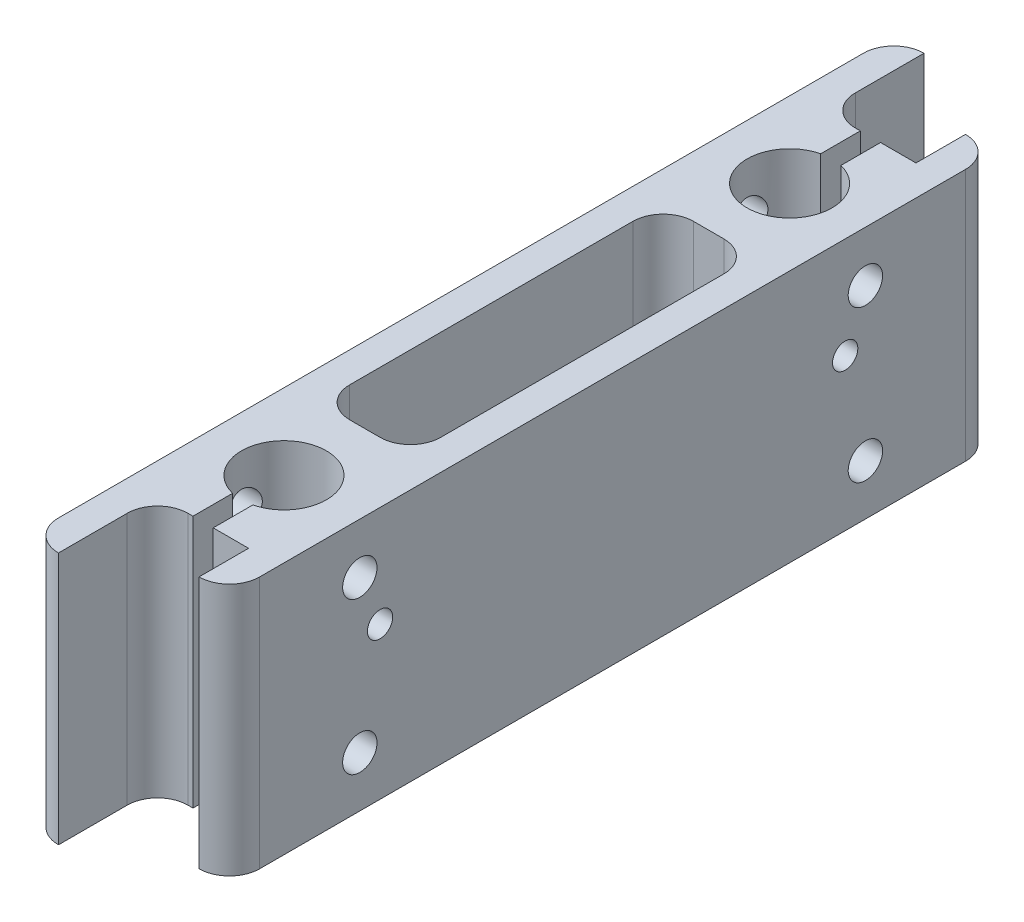
from build123d import *

# Parameters (mm, degrees)
SKETCH_2_R          = 4.2
EXTRUDE_1_DEPTH     = 25
FILLET_1_R          = 3
CUT_EXTRUDE_1_DEPTH = 25
SKETCH_4_W          = 2
SKETCH_4_H          = 9.772408651
SKETCH_4_H_2        = 10.02993421
CUT_EXTRUDE_2_DEPTH = 25
SKETCH_5_R          = 1.25
CUT_EXTRUDE_3_DEPTH = 35
SKETCH_6_R          = 1.7
CUT_EXTRUDE_4_DEPTH = 32


with BuildPart() as part:
    # 草图2 → 凸台-拉伸1 (new body)
    with BuildSketch(Plane(origin=(0, 0, 0), x_dir=(1, 0, 0), z_dir=(0, 1, 0))):
        Polygon((-10.5, 44.6), (-10.5, 34.8), (-1.5, 34.8), (-1.5, 39.7), (1.5, 39.7), (1.5, -36.1), (-1.5, -36.1), (-1.5, -31.2), (-10.5, -31.2), (-10.5, -41), (-13.5, -41), (-13.5, 44.6), align=None)
        with Locations(Location((-6, -23.2, 0), (0, 0, 270))):
            Circle(SKETCH_2_R, mode=Mode.SUBTRACT)
        with Locations(Location((-6, 26.8, 0), (0, 0, 270))):
            Circle(SKETCH_2_R, mode=Mode.SUBTRACT)
    extrude(amount=EXTRUDE_1_DEPTH)

    # 圆角1
    fillet_1_edges = [part.edges().sort_by_distance(p)[0] for p in [
        (1.5, 12.5, 36.1),
        (1.5, 12.5, -39.7),
        (-10.5, 12.5, -34.8),
        (-10.5, 12.5, 31.2),
        (-13.5, 12.5, -44.6),
        (-13.5, 12.5, 41),
    ]]
    fillet(fillet_1_edges, radius=FILLET_1_R - 0.0001)  # a hair under: the kernel refuses the full size

    # 草图3 → 切除-拉伸1 (cut)
    with BuildSketch(Plane(origin=(0, 25, 0), x_dir=(1, 0, 0), z_dir=(0, 1, 0))):
        with BuildLine():
            Line((-7.5, 18.8), (-4.5, 18.8))
            ThreePointArc((-4.5, 18.8), (-2.378679656, 17.921320344), (-1.5, 15.8))
            Line((-1.5, 15.8), (-1.5, -12.2))
            ThreePointArc((-1.5, -12.2), (-2.378679656, -14.321320344), (-4.5, -15.2))
            Line((-4.5, -15.2), (-7.5, -15.2))
            ThreePointArc((-7.5, -15.2), (-9.621320344, -14.321320344), (-10.5, -12.2))
            Line((-10.5, -12.2), (-10.5, 15.8))
            ThreePointArc((-10.5, 15.8), (-9.621320344, 17.921320344), (-7.5, 18.8))
        make_face()
    extrude(amount=-CUT_EXTRUDE_1_DEPTH, mode=Mode.SUBTRACT)

    # 草图4 → 切除-拉伸2 (cut)
    with BuildSketch(Plane(origin=(0, 25, 0), x_dir=(1, 0, 0), z_dir=(0, 1, 0))):
        with Locations((-6, -31.836216801)):
            Rectangle(SKETCH_4_W, SKETCH_4_H)
        with Locations((-6, 32.148208176)):
            Rectangle(SKETCH_4_W, SKETCH_4_H_2)
    extrude(amount=-CUT_EXTRUDE_2_DEPTH, mode=Mode.SUBTRACT)

    # 草图5 → 切除-拉伸3 (cut)
    with BuildSketch(Plane(origin=(1.5, 0, 0), x_dir=(0, 0, -1), z_dir=(1, 0, 0))):
        with Locations((-21.2, 15)):
            Circle(SKETCH_5_R)
        with Locations((24.8, 15)):
            Circle(SKETCH_5_R)
    extrude(amount=-CUT_EXTRUDE_3_DEPTH, mode=Mode.SUBTRACT)

    # 草图6 → 切除-拉伸4 (cut)
    with BuildSketch(Plane(origin=(1.5, 0, 0), x_dir=(0, 0, -1), z_dir=(1, 0, 0))):
        with Locations((26.8, 5)):
            Circle(SKETCH_6_R)
        with Locations((26.8, 20)):
            Circle(SKETCH_6_R)
        with Locations((-23.2, 5)):
            Circle(SKETCH_6_R)
        with Locations((-23.2, 20)):
            Circle(SKETCH_6_R)
    extrude(amount=-CUT_EXTRUDE_4_DEPTH, mode=Mode.SUBTRACT)


solid = part.part
